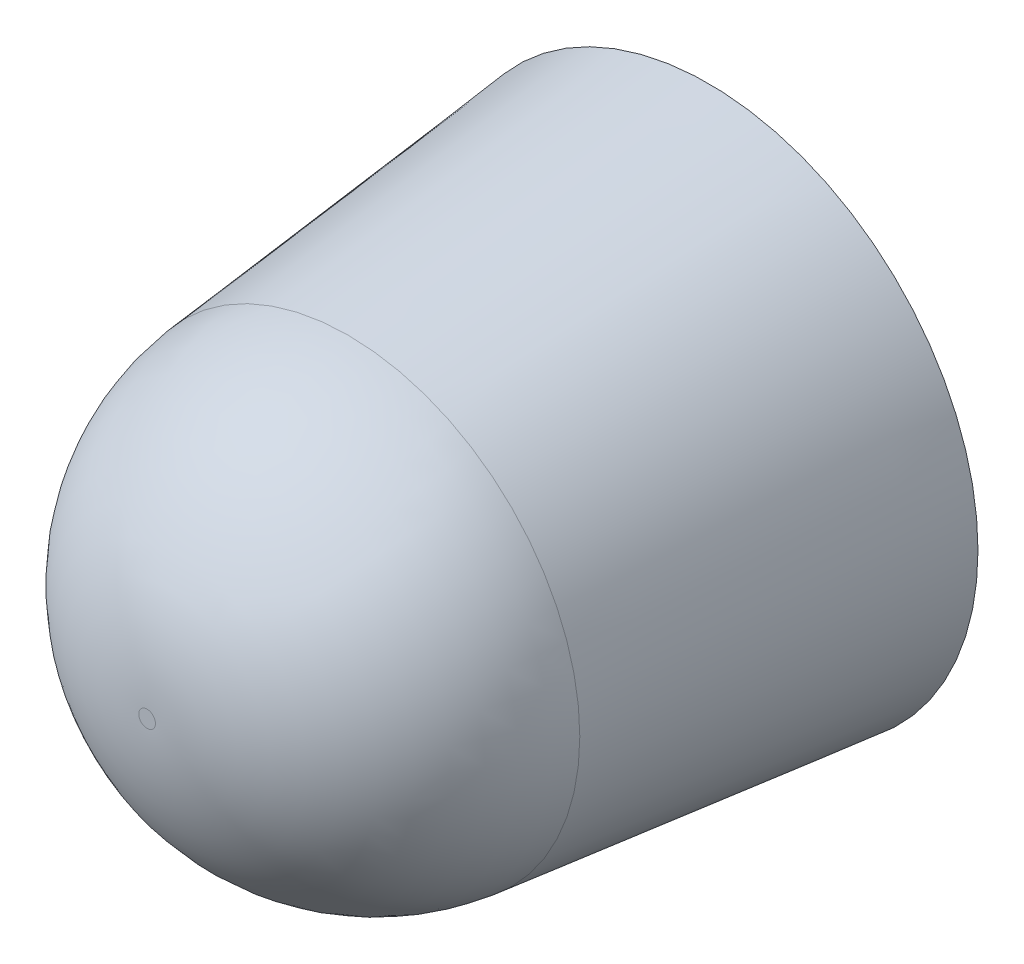
from build123d import *

# Parameters (mm, degrees)
SKETCH1_R           = 75.00000000000001
BOSS_EXTRUDE1_DEPTH = 200.00000000000003
DRAFT1_ANGLE        = 6.000000000000013
FILLET1_R           = 80
SHELL1_T            = -10
FILLET2_R           = 60


with BuildPart() as part:
    # Sketch1 → Boss-Extrude1 (new body)
    with BuildSketch(Plane.XY):
        Circle(SKETCH1_R)
    extrude(amount=BOSS_EXTRUDE1_DEPTH)

    # Draft1
    draft1_faces = [part.faces().sort_by_distance(p)[0] for p in [
        (-75.00000000000001, 9.18e-15, 100.00000000000001),
    ]]
    draft(draft1_faces, Plane.XY.offset(200.00000000000003), DRAFT1_ANGLE)

    # Fillet1
    fillet1_edges = [part.edges().sort_by_distance(p)[0] for p in [
        (-75.00000000000003, 9.18e-15, 200.00000000000003),
    ]]
    fillet(fillet1_edges, radius=FILLET1_R)

    # Shell1
    shell1_openings = [part.faces().sort_by_distance(p)[0] for p in [
        (0, 0, 0),
    ]]
    offset(amount=SHELL1_T, openings=shell1_openings, kind=Kind.INTERSECTION)

    # Fillet2
    # the kernel refuses this fillet: 60 mm, written as the material it takes off along each edge
    with BuildSketch(Plane(origin=(0, 0, 0), x_dir=(1, 0, 0), z_dir=(0, 1, 0))) as fillet2_piece_1:
        with BuildLine():
            CenterArc((142.2801248958351, -38.210982890692364), FILLET2_R, 140.44269023806876, 33.557309761931236)
            Line((82.60881117373867, -31.939275094633143), (81.41538489929674, -31.81384093871196))
            Line((81.41538489929674, -31.81384093871196), (84.77233798305825, 0.12543415592118445))
            Line((84.77233798305825, 0.12543415592118445), (85.96576425750018, 1.2000000000000002))
            ThreePointArc((85.96576425750018, 1.2000000000000002), (90.99330565532057, 1.2000000000000002), (95.0956614962871, 0.7642196578091147))
            Line((95.0956614962871, 0.7642196578091147), (96.02084705314097, -4.63984e-12))
        make_face()
    revolve(axis=Axis((0, 0, 0), (0, 0, -1)), mode=Mode.SUBTRACT)


solid = part.part
